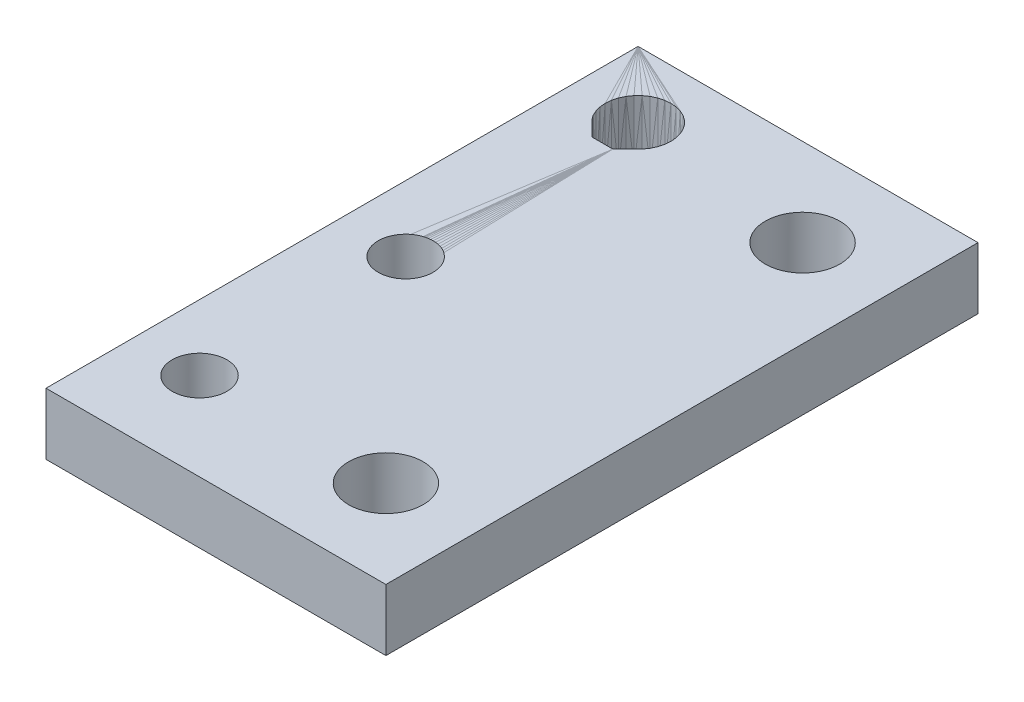
from build123d import *

# Parameters (mm, degrees)
RESSALTO_EXTRUS_O1_START   = -2.81
RESSALTO_EXTRUS_O1_DEPTH   = 2.81
RESSALTO_EXTRUS_O1_START_2 = -11.039175584
RESSALTO_EXTRUS_O1_2_DEPTH = 8.229175584
RESSALTO_EXTRUS_O1_3_DEPTH = 2.81
RESSALTO_EXTRUS_O1_START_3 = -12.229175584
RESSALTO_EXTRUS_O1_4_DEPTH = 1.19
RESSALTO_EXTRUS_O1_START_4 = -10.229175584
RESSALTO_EXTRUS_O1_5_DEPTH = 2
RESSALTO_EXTRUS_O1_6_DEPTH = 11.1
RESSALTO_EXTRUS_O1_7_DEPTH = 13.5
RESSALTO_EXTRUS_O1_START_5 = 11.1
RESSALTO_EXTRUS_O1_8_DEPTH = 2.4
ESBO_O2_R                  = 1.25
CORTE_EXTRUS_O1_DEPTH      = 10
CORTE_EXTRUS_O2_DEPTH      = 11.1
ESBO_O4_W                  = 7.32569207
ESBO_O4_H                  = 2.81
RESSALTO_EXTRUS_O2_DEPTH   = 27
CORTE_EXTRUS_O3_DEPTH      = 10
CORTE_EXTRUS_O3_DEPTH_BACK = 10
ESBO_O5_R                  = 1.7


with BuildPart() as part:
    # Ressalto-extrusão1: read off the stored shape, not the designer's step
    # Ressalto-extrusão1 outline → Ressalto-extrusão1 (new body)
    with BuildSketch(Plane(origin=(0, 12.229175584, 0), x_dir=(1, 0, 0), z_dir=(0, 1, 0)).offset(RESSALTO_EXTRUS_O1_START)):
        Polygon((2.81, -27), (15.31, -27), (15.31, -13.5), (15.31, 0), (2.81, 0), align=None)
        Polygon((4.510961894, -3.75), (4.400461069, -3.513030215), (4.33278837, -3.260472267), (4.31, -3), (4.33278837, -2.739527733), (4.400461069, -2.486969785), (4.510961894, -2.25), (4.660933335, -2.035818585), (4.845818585, -1.850933335), (5.06, -1.700961894), (5.296969785, -1.590461069), (5.549527734, -1.52278837), (5.81, -1.5), (6.070472267, -1.52278837), (6.323030215, -1.590461069), (6.56, -1.700961894), (6.774181415, -1.850933335), (6.959066665, -2.035818585), (7.109038106, -2.25), (7.219538931, -2.486969785), (7.28721163, -2.739527733), (7.31, -3), (7.28721163, -3.260472267), (7.219538931, -3.513030215), (7.109038106, -3.75), (6.959066665, -3.964181415), (6.774181415, -4.149066665), (6.292090707, -4.631157372), (5.327909293, -4.631157372), (4.660933335, -3.964181415), align=None, mode=Mode.SUBTRACT)
    extrude(amount=RESSALTO_EXTRUS_O1_DEPTH)

    # Ressalto-extrus_o1 2 outline → Ressalto-extrus_o1 2 (add)
    with BuildSketch(Plane(origin=(0, 12.229175584, 0), x_dir=(1, 0, 0), z_dir=(0, 1, 0)).offset(RESSALTO_EXTRUS_O1_START_2)):
        Polygon((3.005299462, -7.857883832), (2.81, -7.519615241), (2.81, -11.1), (15.31, -11.1), (15.31, 0), (9.687350269, 0), (11.419401077, -3), (8.614700538, -7.857883832), align=None)
    extrude(amount=RESSALTO_EXTRUS_O1_2_DEPTH)

    # Ressalto-extrus_o1 3 outline → Ressalto-extrus_o1 3 (add)
    with BuildSketch(Plane(origin=(0, 12.229175584, 0), x_dir=(1, 0, 0), z_dir=(0, 1, 0)).offset(RESSALTO_EXTRUS_O1_START_2)):
        Polygon((2.51, -3), (4.242050808, 0), (0, 0), (0, -11.1), (2.81, -11.1), (2.81, -7.519615241), (3.005299462, -7.857883832), (8.614700538, -7.857883832), (11.419401077, -3), (9.687350269, 0), (7.377949192, 0), (9.11, -3), (7.46, -5.857883832), (4.16, -5.857883832), align=None)
    extrude(amount=RESSALTO_EXTRUS_O1_3_DEPTH)

    # Ressalto-extrus_o1 4 outline → Ressalto-extrus_o1 4 (add)
    with BuildSketch(Plane(origin=(0, 12.229175584, 0), x_dir=(1, 0, 0), z_dir=(0, 1, 0)).offset(RESSALTO_EXTRUS_O1_START_3)):
        Polygon((2.51, -3), (4.242050808, 0), (1.932649731, 0), (0.200598923, -3), (3.005299462, -7.857883832), (8.614700538, -7.857883832), (11.419401077, -3), (9.687350269, 0), (7.377949192, 0), (9.11, -3), (7.46, -5.857883832), (4.16, -5.857883832), align=None)
    extrude(amount=RESSALTO_EXTRUS_O1_4_DEPTH)

    # Ressalto-extrus_o1 5 outline → Ressalto-extrus_o1 5 (add)
    with BuildSketch(Plane(origin=(0, 12.229175584, 0), x_dir=(1, 0, 0), z_dir=(0, 1, 0)).offset(RESSALTO_EXTRUS_O1_START_4)):
        Polygon((2.51, -3), (4.16, -5.857883832), (7.46, -5.857883832), (9.11, -3), (7.377949192, 0), (4.242050808, 0), align=None)
        Polygon((4.400461069, -3.513030215), (4.33278837, -3.260472267), (4.31, -3), (4.33278837, -2.739527733), (4.400461069, -2.486969785), (4.510961894, -2.25), (4.660933335, -2.035818585), (4.845818585, -1.850933335), (5.06, -1.700961894), (5.296969785, -1.590461069), (5.549527734, -1.52278837), (5.81, -1.5), (6.070472267, -1.52278837), (6.323030215, -1.590461069), (6.56, -1.700961894), (6.774181415, -1.850933335), (6.959066665, -2.035818585), (7.109038106, -2.25), (7.219538931, -2.486969785), (7.28721163, -2.739527733), (7.31, -3), (7.28721163, -3.260472267), (7.219538931, -3.513030215), (7.109038106, -3.75), (6.959066665, -3.964181415), (6.774181415, -4.149066665), (6.292090707, -4.631157372), (5.327909293, -4.631157372), (4.660933335, -3.964181415), (4.510961894, -3.75), align=None, mode=Mode.SUBTRACT)
    extrude(amount=RESSALTO_EXTRUS_O1_5_DEPTH)

    # Ressalto-extrus_o1 6 outline → Ressalto-extrus_o1 6 (add)
    with BuildSketch(Plane.XY):
        Polygon((17.745732851, 5.751121431), (17.829587792, 6.709587792), (17.745732851, 7.668054154), (17.496715918, 8.597398), (17.090103246, 9.469381688), (16.538249557, 10.257510436), (15.857922643, 10.937837349), (15.31, 11.321496914), (15.31, 2.097678671), (15.857922643, 2.481338236), (16.538249557, 3.161665149), (17.090103246, 3.949793896), (17.496715918, 4.821777584), align=None)
    extrude(amount=RESSALTO_EXTRUS_O1_6_DEPTH)

    # Ressalto-extrus_o1 7 outline → Ressalto-extrus_o1 7 (cut)
    with BuildSketch(Plane.XY):
        Polygon((15.31, 1.19), (15.31, 2.097678671), (15.069793896, 1.929484546), (13.96, 1.19), align=None)
        Polygon((15.264423259, 6.188643259), (15.31, 6.709587792), (15.264423259, 7.230532325), (15.129077862, 7.735648222), (14.908076211, 8.209587792), (14.608133329, 8.637950621), (14.238362829, 9.007721122), (13.81, 9.307664004), (13.33606043, 9.528665655), (12.830944533, 9.664011051), (12.378861267, 9.703563212), (12.368467114, 9.704472583), (12.31, 9.709587792), (12.049527733, 9.686799421), (11.789055467, 9.664011051), (11.536497519, 9.596338353), (11.28393957, 9.528665655), (11.166538463, 9.473920619), (11.049137357, 9.419175584), (2.81, 9.419175584), (2.81, 4), (11.049137357, 4), (11.28393957, 3.89050993), (11.789055467, 3.755164533), (12.31, 3.709587792), (12.830944533, 3.755164533), (13.33606043, 3.89050993), (13.81, 4.111511581), (14.238362829, 4.411454463), (14.608133329, 4.781224963), (14.908076211, 5.209587792), (15.129077862, 5.683527362), align=None)
    extrude(amount=RESSALTO_EXTRUS_O1_7_DEPTH, mode=Mode.SUBTRACT)

    # Ressalto-extrus_o1 8 outline → Ressalto-extrus_o1 8 (cut)
    with BuildSketch(Plane.XY.offset(RESSALTO_EXTRUS_O1_START_5)):
        Polygon((15.31, 9.419175584), (15.31, 9.709587792), (12.378861267, 9.703563212), (12.830944533, 9.664011051), (13.33606043, 9.528665655), (13.570862645, 9.419175584), align=None)
    extrude(amount=RESSALTO_EXTRUS_O1_8_DEPTH, mode=Mode.SUBTRACT)

    # Esboço2 → Corte-extrusão1 (cut)
    with BuildSketch(Plane(origin=(0, 12.229175584, 0), x_dir=(1, 0, 0), z_dir=(0, 1, 0))):
        with Locations(Location((5.81, -13.6, 0), (0, 0, 138.045690322))):
            Circle(ESBO_O2_R)
        with Locations(Location((5.81, -23, 0), (0, 0, 180))):
            Circle(ESBO_O2_R)
    extrude(amount=-CORTE_EXTRUS_O1_DEPTH, mode=Mode.SUBTRACT)

    # Esboço3 → Corte-extrusão2 (cut)
    with BuildSketch(Plane(origin=(0, 0, 0), x_dir=(-1, 0, 0), z_dir=(0, 0, -1))):
        Polygon((-15.31, 11.321496914), (-15.28721163, 9.27601462), (-11.049137357, 9.419175584), (-11.049137357, 5.796906152), (1.171598193, 5.796906152), (1.171598193, -2.184845068), (-19.517418651, -2.184845068), (-19.517418651, 11.321496914), align=None)
    extrude(amount=-CORTE_EXTRUS_O2_DEPTH, mode=Mode.SUBTRACT)

    # Esboço4 → Ressalto-extrusão2 (add)
    with BuildSketch(Plane.XY.offset(27)):
        with Locations((14.647153965, 10.824175584)):
            Rectangle(ESBO_O4_W, ESBO_O4_H)
    extrude(amount=-RESSALTO_EXTRUS_O2_DEPTH)

    # Esboço5 → Corte-extrusão3 (cut, two sides: drawn at the far end of the back side and taken through both)
    with BuildSketch(Plane.XZ.offset(-9.419175584).offset(-CORTE_EXTRUS_O3_DEPTH_BACK)):
        with Locations(Location((14.31, 23, 0), (0, 0, 90))):
            Circle(ESBO_O5_R)
        with Locations(Location((14.31, 4, 0), (0, 0, 90))):
            Circle(ESBO_O5_R)
    extrude(amount=CORTE_EXTRUS_O3_DEPTH + CORTE_EXTRUS_O3_DEPTH_BACK, mode=Mode.SUBTRACT)


solid = part.part
